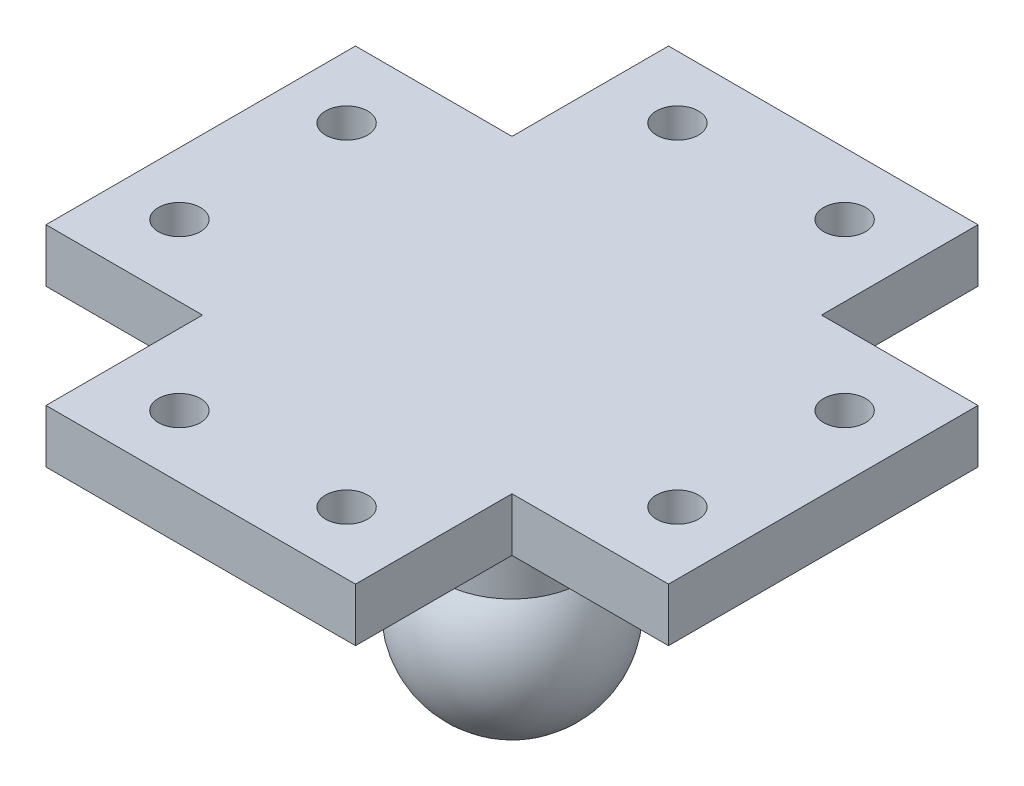
from build123d import *

# Parameters (mm, degrees)
SKETCH2_R           = 1.5
BOSS_EXTRUDE1_DEPTH = 3.81
FILLET1_R           = 5.08


with BuildPart() as part:
    # Sketch1 → Revolve3 (revolve)
    with BuildSketch(Plane.XY):
        with BuildLine():
            ThreePointArc((-5.08, 4.219764922), (-5.978300074, -2.805841091), (0, -6.604))
            Line((0, -6.604), (0, 6.604))
            Line((0, 6.604), (0, 14.379764922))
            Line((0, 14.379764922), (-5.08, 14.379764922))
            Line((-5.08, 14.379764922), (-5.08, 4.219764922))
        make_face()
    revolve(axis=Axis((0, -6.604, 0), (0, 1, 0)))

    # Sketch2 → Boss-Extrude1 (add)
    with BuildSketch(Plane(origin=(0, 14.379764922, 0), x_dir=(1, 0, 0), z_dir=(0, 1, 0))):
        Polygon((-11.049, 11.049), (-22.225, 11.049), (-22.225, -11.049), (-11.049, -11.049), (-11.049, -22.225), (11.049, -22.225), (11.049, -11.049), (22.225, -11.049), (22.225, 11.049), (11.049, 11.049), (11.049, 22.225), (-11.049, 22.225), align=None)
        with Locations((-17.78, -5.969)):
            Circle(SKETCH2_R, mode=Mode.SUBTRACT)
        with Locations((-17.78, 5.969)):
            Circle(SKETCH2_R, mode=Mode.SUBTRACT)
        with Locations((5.969, 17.78)):
            Circle(SKETCH2_R, mode=Mode.SUBTRACT)
        with Locations((-5.969, 17.78)):
            Circle(SKETCH2_R, mode=Mode.SUBTRACT)
        with Locations((17.78, 5.969)):
            Circle(SKETCH2_R, mode=Mode.SUBTRACT)
        with Locations((17.78, -5.969)):
            Circle(SKETCH2_R, mode=Mode.SUBTRACT)
        with Locations((5.969, -17.78)):
            Circle(SKETCH2_R, mode=Mode.SUBTRACT)
        with Locations((-5.969, -17.78)):
            Circle(SKETCH2_R, mode=Mode.SUBTRACT)
    extrude(amount=BOSS_EXTRUDE1_DEPTH)

    # Fillet1
    fillet1_edges = [part.edges().sort_by_distance(p)[0] for p in [
        (5.08, 14.379764922, 0),
    ]]
    fillet(fillet1_edges, radius=FILLET1_R)


solid = part.part
